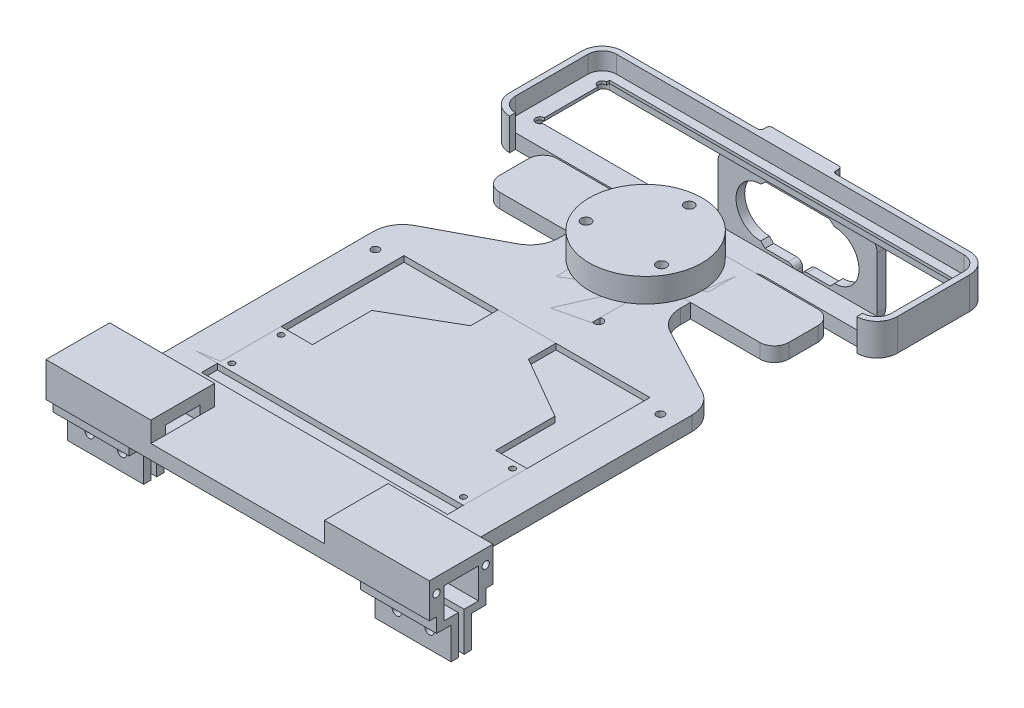
from build123d import *

# Parameters (mm, degrees)
BOSS_EXTRUDE1_START       = -2.5
BOSS_EXTRUDE1_DEPTH       = 5
BOSS_EXTRUDE1_2_OUTLINE_R = 1
BOSS_EXTRUDE1_2_DEPTH     = 5
BOSS_EXTRUDE1_START_2     = -7.5
BOSS_EXTRUDE1_3_OUTLINE_W = 20
BOSS_EXTRUDE1_3_OUTLINE_H = 5
BOSS_EXTRUDE1_3_OUTLINE_R = 1
BOSS_EXTRUDE1_3_DEPTH     = 5
BOSS_EXTRUDE1_START_3     = -0.5
BOSS_EXTRUDE1_4_OUTLINE_W = 20
BOSS_EXTRUDE1_4_OUTLINE_H = 12
BOSS_EXTRUDE1_4_DEPTH     = 3
BOSS_EXTRUDE1_5_OUTLINE_W = 20
BOSS_EXTRUDE1_5_OUTLINE_H = 12
BOSS_EXTRUDE1_5_DEPTH     = 2
SKETCH2_W                 = 20
SKETCH2_H                 = 12
CUT_EXTRUDE1_DEPTH        = 3
BOSS_EXTRUDE3_START       = -5
BOSS_EXTRUDE3_DEPTH       = 11
BOSS_EXTRUDE4_DEPTH       = 20
BOSS_EXTRUDE5_DEPTH       = 20
CUT_EXTRUDE8_DEPTH        = 120.378599422
CUT_EXTRUDE9_DEPTH        = 4
SKETCH17_W                = 30
SKETCH17_H                = 22
BOSS_EXTRUDE6_DEPTH       = 5
SKETCH18_W                = 12
SKETCH18_H                = 5
CUT_EXTRUDE11_DEPTH       = 30
SKETCH19_W                = 12
SKETCH19_H                = 5
CUT_EXTRUDE12_DEPTH       = 30
SKETCH16_W                = 85
SKETCH16_H                = 70
CUT_EXTRUDE13_DEPTH       = 2
SKETCH20_R                = 19.5
BOSS_EXTRUDE7_DEPTH       = 13.29
FILLET1_R                 = 10
FILLET2_R                 = 5
SKETCH21_W                = 30
SKETCH21_H                = 22
BOSS_EXTRUDE8_DEPTH       = 5
CUT_EXTRUDE14_DEPTH       = 122.873516811
CUT_EXTRUDE14_DEPTH_BACK  = 122.873516811
SKETCH22_R                = 1.7
SKETCH23_R                = 1.5
SKETCH23_R_2              = 1.35
CUT_EXTRUDE15_DEPTH       = 120.378599422
SKETCH26_W                = 30
SKETCH26_H                = 22
CUT_EXTRUDE17_DEPTH       = 3
BOSS_EXTRUDE11_DEPTH      = 6.25
SKETCH14_R                = 1.6
CUT_EXTRUDE6_DEPTH        = 199.094674335
BOSS_EXTRUDE10_DEPTH      = 3
BOSS_EXTRUDE12_DEPTH      = 10
SKETCH41_R                = 1.25
CUT_EXTRUDE19_DEPTH       = 9
SKETCH42_R                = 1.5
CUT_EXTRUDE20_DEPTH       = 125.102779985
FILLET4_R                 = 1


# Read off the part's stored shape, not the designer's step: Boss-Extrude1
with BuildPart() as part:
    # Boss-Extrude1 outline → Boss-Extrude1 (new body)
    with BuildSketch(Plane(origin=(0, 0, 0), x_dir=(1, 0, 0), z_dir=(0, 1, 0)).offset(BOSS_EXTRUDE1_START)):
        with BuildLine():
            Line((-60, 60.5), (-21, 60.5))
            Line((-21, 60.5), (-21, 30.5))
            Line((-21, 30.5), (-55, 12.5))
            Line((-55, 12.5), (-55, -73.5))
            Line((-55, -73.5), (-60, -73.5))
            Line((-60, -73.5), (-60, -95.5))
            Line((-60, -95.5), (60, -95.5))
            Line((60, -95.5), (60, -73.5))
            Line((60, -73.5), (55, -73.5))
            Line((55, -73.5), (55, 12.5))
            Line((55, 12.5), (21, 30.5))
            Line((21, 30.5), (21, 60.5))
            Line((21, 60.5), (60, 60.5))
            ThreePointArc((60, 60.5), (63.535533906, 61.964466094), (65, 65.5))
            Line((65, 65.5), (65, 90.5))
            ThreePointArc((65, 90.5), (63.535533906, 94.035533906), (60, 95.5))
            Line((60, 95.5), (-60, 95.5))
            ThreePointArc((-60, 95.5), (-63.535533906, 94.035533906), (-65, 90.5))
            Line((-65, 90.5), (-65, 65.5))
            ThreePointArc((-65, 65.5), (-63.535533906, 61.964466094), (-60, 60.5))
        make_face()
    extrude(amount=BOSS_EXTRUDE1_DEPTH)

    # Sketch2 → Cut-Extrude1 (cut)
    with BuildSketch(Plane.XZ.offset(2.5)):
        with Locations((-50, 84.5)):
            Rectangle(SKETCH2_W, SKETCH2_H)
        with Locations((50, 84.5)):
            Rectangle(SKETCH2_W, SKETCH2_H)
    extrude(amount=-CUT_EXTRUDE1_DEPTH, mode=Mode.SUBTRACT)

    # Sketch5 → Boss-Extrude3 (add)
    with BuildSketch(Plane(origin=(0, 2.5, 0), x_dir=(1, 0, 0), z_dir=(0, 1, 0)).offset(BOSS_EXTRUDE3_START)):
        with BuildLine():
            Line((-60, 60.5), (-60, 58.5))
            ThreePointArc((-60, 58.5), (-64.949747468, 60.550252532), (-67, 65.5))
            Line((-67, 65.5), (-67, 90.5))
            ThreePointArc((-67, 90.5), (-64.949747468, 95.449747468), (-60, 97.5))
            Line((-60, 97.5), (60, 97.5))
            ThreePointArc((60, 97.5), (64.949747468, 95.449747468), (67, 90.5))
            Line((67, 90.5), (67, 65.5))
            ThreePointArc((67, 65.5), (64.949747468, 60.550252532), (60, 58.5))
            Line((60, 58.5), (60, 60.5))
            ThreePointArc((60, 60.5), (63.535533906, 61.964466094), (65, 65.5))
            Line((65, 65.5), (65, 90.5))
            ThreePointArc((65, 90.5), (63.535533906, 94.035533906), (60, 95.5))
            Line((60, 95.5), (-60, 95.5))
            ThreePointArc((-60, 95.5), (-63.535533906, 94.035533906), (-65, 90.5))
            Line((-65, 90.5), (-65, 65.5))
            ThreePointArc((-65, 65.5), (-63.535533906, 61.964466094), (-60, 60.5))
        make_face()
    extrude(amount=BOSS_EXTRUDE3_DEPTH)

    # Sketch12 → Boss-Extrude4 (add)
    with BuildSketch(Plane.ZY.offset(60)):
        Polygon((78.5, -2.5), (78.5, -5), (83.5, -5), (83.5, -18.5), (81, -18.5), (81, -7.5), (76, -7.5), (76, -5), (76, -2.5), align=None)
        Polygon((85.5, -18.5), (88, -18.5), (88, -7.5), (93, -7.5), (93, -5), (93, -2.5), (90.5, -2.5), (90.5, -5), (85.5, -5), align=None)
    extrude(amount=-BOSS_EXTRUDE4_DEPTH)

    # Sketch13 → Boss-Extrude5 (add)
    with BuildSketch(Plane(origin=(60, 0, 0), x_dir=(0, 0, -1), z_dir=(1, 0, 0))):
        Polygon((-90.5, -2.5), (-90.5, -5), (-85.5, -5), (-85.5, -18.5), (-88, -18.5), (-88, -7.5), (-93, -7.5), (-93, -2.5), align=None)
        Polygon((-83.5, -18.5), (-81, -18.5), (-81, -7.5), (-76, -7.5), (-76, -2.5), (-78.5, -2.5), (-78.5, -5), (-83.5, -5), align=None)
    extrude(amount=-BOSS_EXTRUDE5_DEPTH)

    # Sketch15 → Cut-Extrude8 (cut, through all)
    with BuildSketch(Plane.XZ.offset(2.5)):
        with BuildLine():
            Line((-59.5, -91.5), (-59.5, -92.5))
            Line((-59.5, -92.5), (59.5, -92.5))
            Line((59.5, -92.5), (59.5, -91.5))
            ThreePointArc((59.5, -91.5), (61, -90), (59.5, -88.5))
            Line((59.5, -88.5), (59.5, -70))
            ThreePointArc((59.5, -70), (60.724744871, -67.633974596), (58.085786438, -68))
            Line((58.085786438, -68), (-58.085786438, -68))
            ThreePointArc((-58.085786438, -68), (-60.724744871, -67.633974596), (-59.5, -70))
            Line((-59.5, -70), (-59.5, -88.5))
            ThreePointArc((-59.5, -88.5), (-61, -90), (-59.5, -91.5))
        make_face()
    extrude(amount=-CUT_EXTRUDE8_DEPTH, mode=Mode.SUBTRACT)

    # Sketch15<3> → Cut-Extrude9 (cut)
    with BuildSketch(Plane.XZ.offset(2.5)):
        with BuildLine():
            Line((-61.5, -64.5), (61.5, -64.5))
            ThreePointArc((61.5, -64.5), (62.914213562, -65.085786438), (63.5, -66.5))
            Line((63.5, -66.5), (63.5, -92.5))
            ThreePointArc((63.5, -92.5), (62.914213562, -93.914213562), (61.5, -94.5))
            Line((61.5, -94.5), (-61.5, -94.5))
            ThreePointArc((-61.5, -94.5), (-62.914213562, -93.914213562), (-63.5, -92.5))
            Line((-63.5, -92.5), (-63.5, -66.5))
            ThreePointArc((-63.5, -66.5), (-62.914213562, -65.085786438), (-61.5, -64.5))
        make_face()
    extrude(amount=-CUT_EXTRUDE9_DEPTH, mode=Mode.SUBTRACT)

    # Sketch17 → Boss-Extrude6 (add)
    with BuildSketch(Plane(origin=(0, 2.5, 0), x_dir=(1, 0, 0), z_dir=(0, 1, 0))):
        with Locations((-45, -84.5)):
            Rectangle(SKETCH17_W, SKETCH17_H)
        with Locations((45, -84.5)):
            Rectangle(SKETCH17_W, SKETCH17_H)
    extrude(amount=BOSS_EXTRUDE6_DEPTH)

    # Sketch18 → Cut-Extrude11 (cut)
    with BuildSketch(Plane(origin=(60, 0, 0), x_dir=(0, 0, -1), z_dir=(1, 0, 0))):
        with Locations((-84.5, 3)):
            Rectangle(SKETCH18_W, SKETCH18_H)
    extrude(amount=-CUT_EXTRUDE11_DEPTH, mode=Mode.SUBTRACT)

    # Sketch19 → Cut-Extrude12 (cut)
    with BuildSketch(Plane.ZY.offset(60)):
        with Locations((84.5, 3)):
            Rectangle(SKETCH19_W, SKETCH19_H)
    extrude(amount=-CUT_EXTRUDE12_DEPTH, mode=Mode.SUBTRACT)

    # Sketch16 → Cut-Extrude13 (cut)
    with BuildSketch(Plane(origin=(0, 2.5, 0), x_dir=(1, 0, 0), z_dir=(0, 1, 0))):
        with Locations((0, -30.5)):
            Rectangle(SKETCH16_W, SKETCH16_H)
    extrude(amount=-CUT_EXTRUDE13_DEPTH, mode=Mode.SUBTRACT)

    # Sketch20 → Boss-Extrude7 (add)
    with BuildSketch(Plane.XZ.offset(2.5)):
        with Locations(Location((0, -45.5, 0), (0, 0, 270))):
            Circle(SKETCH20_R)
    extrude(amount=-BOSS_EXTRUDE7_DEPTH)

    # Fillet1
    fillet1_edges = [part.edges().sort_by_distance(p)[0] for p in [
        (21, 0, -30.5),
        (55, 0, -12.5),
        (-55, 0, -12.5),
        (-21, 0, -30.5),
    ]]
    fillet(fillet1_edges, radius=FILLET1_R)

    # Fillet2
    fillet2_edges = [part.edges().sort_by_distance(p)[0] for p in [
        (21, 0, -60.5),
        (-21, 0, -60.5),
    ]]
    fillet(fillet2_edges, radius=FILLET2_R)

    # Sketch21 → Boss-Extrude8 (add)
    with BuildSketch(Plane(origin=(0, 7.5, 0), x_dir=(1, 0, 0), z_dir=(0, 1, 0))):
        with Locations((45, -84.5)):
            Rectangle(SKETCH21_W, SKETCH21_H)
        with Locations((-45, -84.5)):
            Rectangle(SKETCH21_W, SKETCH21_H)
    extrude(amount=BOSS_EXTRUDE8_DEPTH)

    # Sketch22 → Cut-Extrude14 (cut, two sides: drawn at the far end of the back side and taken through both)
    with BuildSketch(Plane(origin=(0, 10.79, 0), x_dir=(1, 0, 0), z_dir=(0, 1, 0)).offset(-CUT_EXTRUDE14_DEPTH_BACK)):
        with Locations(Location((0, 60.575, 0), (0, 0, 270))):
            Circle(SKETCH22_R)
        with Locations(Location((13.055332962, 37.9625, 0), (0, 0, 270))):
            Circle(SKETCH22_R)
        with Locations(Location((-13.055332962, 37.9625, 0), (0, 0, 270))):
            Circle(SKETCH22_R)
    extrude(amount=CUT_EXTRUDE14_DEPTH + CUT_EXTRUDE14_DEPTH_BACK, mode=Mode.SUBTRACT)

    # Sketch23 → Cut-Extrude15 (cut, through all)
    with BuildSketch(Plane.XZ.offset(2.5)):
        with Locations(Location((0, 52.5, 0), (0, 0, 270))):
            Circle(SKETCH23_R)
        with Locations(Location((0, 11.5, 0), (0, 0, 270))):
            Circle(SKETCH23_R)
        with Locations(Location((-49.2665, 70.15, 0), (0, 0, 270))):
            Circle(SKETCH23_R_2)
        with Locations(Location((49.2665, 70.15, 0), (0, 0, 270))):
            Circle(SKETCH23_R_2)
        with Locations(Location((49.2665, -1.35, 0), (0, 0, 270))):
            Circle(SKETCH23_R_2)
        with Locations(Location((-49.2665, -1.35, 0), (0, 0, 270))):
            Circle(SKETCH23_R_2)
    extrude(amount=-CUT_EXTRUDE15_DEPTH, mode=Mode.SUBTRACT)

    # Sketch26 → Cut-Extrude17 (cut)
    with BuildSketch(Plane(origin=(0, 12.5, 0), x_dir=(1, 0, 0), z_dir=(0, 1, 0))):
        with Locations((45, -84.5)):
            Rectangle(SKETCH26_W, SKETCH26_H)
        with Locations((-45, -84.5)):
            Rectangle(SKETCH26_W, SKETCH26_H)
    extrude(amount=-CUT_EXTRUDE17_DEPTH, mode=Mode.SUBTRACT)

    # Sketch30 → Boss-Extrude11 (add)
    with BuildSketch(Plane(origin=(60, 0, 0), x_dir=(0, 0, -1), z_dir=(1, 0, 0))):
        Polygon((-73.5, -2.5), (-73.5, 9.5), (-95.5, 9.5), (-95.5, -2.5), (-93, -2.5), (-93, -7.5), (-88, -7.5), (-88, -18.5), (-85.5, -18.5), (-85.5, -5), (-90.5, -5), (-90.5, 5.5), (-78.5, 5.5), (-78.5, -5), (-83.5, -5), (-83.5, -18.5), (-81, -18.5), (-81, -7.5), (-76, -7.5), (-76, -2.5), align=None)
    boss_extrude11 = extrude(amount=BOSS_EXTRUDE11_DEPTH)

    # Mirror2: Boss-Extrude11 across plane
    add(boss_extrude11.mirror(Plane(origin=(0, 0, 0), x_dir=(0, 0, 1), z_dir=(1, 0, 0))))

    # Sketch14 → Cut-Extrude6 (cut, through all)
    with BuildSketch(Plane.XY.offset(88)):
        with Locations((-58.75, -12.5)):
            Circle(SKETCH14_R)
        with Locations((-47.5, -12.5)):
            Circle(SKETCH14_R)
        with Locations((47.5, -12.5)):
            Circle(SKETCH14_R)
        with Locations((58.75, -12.5)):
            Circle(SKETCH14_R)
    extrude(amount=-CUT_EXTRUDE6_DEPTH, mode=Mode.SUBTRACT)

    # Sketch29 → Boss-Extrude10 (add)
    with BuildSketch(Plane(origin=(0, 0, -97.5), x_dir=(-1, 0, 0), z_dir=(0, 0, -1))):
        with BuildLine():
            Line((0.749999494, -27.999999944), (0.749999466, -28.999999944))
            ThreePointArc((0.749999466, -28.999999944), (1.335785884, -30.414213543), (2.749999466, -31))
            Line((2.749999466, -31), (21.999999551, -31))
            ThreePointArc((21.999999551, -31), (25.535533407, -29.535533956), (26.999999551, -26.00000014))
            Line((26.999999551, -26.00000014), (27.000000055, -8.00000014))
            ThreePointArc((27.000000055, -8.00000014), (25.535534011, -4.464466144), (22.000000055, -3))
            Line((22.000000055, -3), (12.250000055, -3))
            Line((12.250000055, -3), (12.250000202, 5.5))
            Line((12.250000202, 5.5), (12.250000202, 8.5))
            Line((12.250000202, 8.5), (-12.749999798, 8.5))
            Line((-12.749999798, 8.5), (-12.749999798, 5.5))
            Line((-12.749999798, 5.5), (-12.749999945, -3))
            Line((-12.749999945, -3), (-22.999999945, -3))
            ThreePointArc((-22.999999945, -3), (-26.535533801, -4.464466044), (-27.999999945, -7.99999986))
            Line((-27.999999945, -7.99999986), (-28.000000449, -25.99999986))
            ThreePointArc((-28.000000449, -25.99999986), (-26.535534405, -29.535533856), (-23.000000449, -31))
            Line((-23.000000449, -31), (-3.750000534, -31))
            ThreePointArc((-3.750000534, -31), (-2.335786991, -30.414213582), (-1.750000534, -29.000000056))
            Line((-1.750000534, -29.000000056), (-1.750000506, -28.000000056))
            ThreePointArc((-1.750000506, -28.000000056), (-2.335786923, -26.585786457), (-3.750000506, -26))
            Line((-3.750000506, -26), (-11.754099977, -26))
            Line((-11.754099977, -26), (-13.2500001, -24.5))
            ThreePointArc((-13.2500001, -24.5), (-21.7500001, -16), (-13.2500001, -7.5))
            Line((-13.2500001, -7.5), (-11.500000135, -6))
            Line((-11.500000135, -6), (10.499999865, -6))
            Line((10.499999865, -6), (12.249999831, -7.5))
            ThreePointArc((12.249999831, -7.5), (20.749999831, -16), (12.249999831, -24.5))
            Line((12.249999831, -24.5), (10.749999494, -26))
            Line((10.749999494, -26), (2.749999494, -26))
            ThreePointArc((2.749999494, -26), (1.335785952, -26.585786418), (0.749999494, -27.999999944))
        make_face()
    extrude(amount=BOSS_EXTRUDE10_DEPTH)

    # Sketch32 → Boss-Extrude12 (add)
    with BuildSketch(Plane(origin=(40, 0, 0), x_dir=(0, 0, -1), z_dir=(1, 0, 0))):
        Polygon((-90.5, 5.5), (-90.5, -5), (-90, 5.5), align=None)
        Polygon((-78.5, -5), (-79, 5.5), (-78.5, 5.5), align=None)
    boss_extrude12 = extrude(amount=BOSS_EXTRUDE12_DEPTH)

    # Mirror3: Boss-Extrude12 across plane
    add(boss_extrude12.mirror(Plane(origin=(0, 0, 0), x_dir=(0, 0, 1), z_dir=(1, 0, 0))))

    # Sketch41 → Cut-Extrude19 (cut)
    with BuildSketch(Plane.ZY.offset(66.25)):
        with Locations((76, 4.5)):
            Circle(SKETCH41_R)
        with Locations((93, 4.5)):
            Circle(SKETCH41_R)
    cut_extrude19 = extrude(amount=-CUT_EXTRUDE19_DEPTH, mode=Mode.SUBTRACT)

    # Sketch42 → Cut-Extrude20 (cut, through all)
    with BuildSketch(Plane.XZ.offset(2.5)):
        with Locations(Location((10.75, -18.5, 0), (0, 0, 270))):
            Circle(SKETCH42_R)
    extrude(amount=-CUT_EXTRUDE20_DEPTH, mode=Mode.SUBTRACT)

    # Mirror7: Cut-Extrude19 across plane
    add(cut_extrude19.mirror(Plane(origin=(0, 0, 0), x_dir=(0, 0, 1), z_dir=(1, 0, 0))), mode=Mode.SUBTRACT)

    # Fillet4
    fillet4_edges = [part.edges().sort_by_distance(p)[0] for p in [
        (12.749999871, 1.25, -100.5),
        (-12.250000129, 1.25, -100.5),
        (12.749999867, 1.5, -97.5),
        (-12.250000133, 1.5, -97.5),
    ]]
    fillet(fillet4_edges, radius=FILLET4_R)


with BuildPart() as body_2:
    # Boss-Extrude1 2 outline → Boss-Extrude1 2 (new body)
    with BuildSketch(Plane(origin=(0, 0, 0), x_dir=(1, 0, 0), z_dir=(0, 1, 0)).offset(BOSS_EXTRUDE1_START)):
        with BuildLine():
            Line((-45, 40), (-10, 40))
            Line((-10, 40), (-10, -5))
            Line((-10, -5), (-31.650635095, -17.5))
            Line((-31.650635095, -17.5), (-31.650635095, -38))
            Line((-31.650635095, -38), (-50, -38))
            Line((-50, -38), (-50, -43))
            Line((-50, -43), (-30, -43))
            Line((-30, -43), (-30, -55))
            Line((-30, -55), (-50, -55))
            Line((-50, -55), (-50, -60))
            Line((-50, -60), (50, -60))
            Line((50, -60), (50, -55))
            Line((50, -55), (30, -55))
            Line((30, -55), (30, -43))
            Line((30, -43), (50, -43))
            Line((50, -43), (50, -38))
            Line((50, -38), (31.650635095, -38))
            Line((31.650635095, -38), (31.650635095, -17.5))
            Line((31.650635095, -17.5), (10, -5))
            Line((10, -5), (10, 40))
            Line((10, 40), (45, 40))
            ThreePointArc((45, 40), (48.535533906, 41.464466094), (50, 45))
            Line((50, 45), (50, 55))
            ThreePointArc((50, 55), (48.535533906, 58.535533906), (45, 60))
            Line((45, 60), (-45, 60))
            ThreePointArc((-45, 60), (-48.535533906, 58.535533906), (-50, 55))
            Line((-50, 55), (-50, 45))
            ThreePointArc((-50, 45), (-48.535533906, 41.464466094), (-45, 40))
        make_face()
        with Locations((40, -40.5)):
            Circle(BOSS_EXTRUDE1_2_OUTLINE_R, mode=Mode.SUBTRACT)
        with Locations((40, -57.5)):
            Circle(BOSS_EXTRUDE1_2_OUTLINE_R, mode=Mode.SUBTRACT)
        with Locations((-40, -57.5)):
            Circle(BOSS_EXTRUDE1_2_OUTLINE_R, mode=Mode.SUBTRACT)
        with Locations((-40, -40.5)):
            Circle(BOSS_EXTRUDE1_2_OUTLINE_R, mode=Mode.SUBTRACT)
    extrude(amount=BOSS_EXTRUDE1_2_DEPTH)

    # Boss-Extrude1 3 outline → Boss-Extrude1 3 (add)
    # profile 1 of 4: a face of its own
    with BuildSketch(Plane(origin=(0, 0, 0), x_dir=(1, 0, 0), z_dir=(0, 1, 0)).offset(BOSS_EXTRUDE1_START_2)):
        with Locations((-40, -40.5)):
            Rectangle(BOSS_EXTRUDE1_3_OUTLINE_W, BOSS_EXTRUDE1_3_OUTLINE_H)
        with Locations((-40, -40.5)):
            Circle(BOSS_EXTRUDE1_3_OUTLINE_R, mode=Mode.SUBTRACT)
    # profile 2 of 4: a face of its own
    with BuildSketch(Plane(origin=(0, 0, 0), x_dir=(1, 0, 0), z_dir=(0, 1, 0)).offset(BOSS_EXTRUDE1_START_2)):
        with Locations((-40, -57.5)):
            Rectangle(BOSS_EXTRUDE1_3_OUTLINE_W, BOSS_EXTRUDE1_3_OUTLINE_H)
        with Locations((-40, -57.5)):
            Circle(BOSS_EXTRUDE1_3_OUTLINE_R, mode=Mode.SUBTRACT)
    # profile 3 of 4: a face of its own
    with BuildSketch(Plane(origin=(0, 0, 0), x_dir=(1, 0, 0), z_dir=(0, 1, 0)).offset(BOSS_EXTRUDE1_START_2)):
        with Locations((40, -57.5)):
            Rectangle(BOSS_EXTRUDE1_3_OUTLINE_W, BOSS_EXTRUDE1_3_OUTLINE_H)
        with Locations((40, -57.5)):
            Circle(BOSS_EXTRUDE1_3_OUTLINE_R, mode=Mode.SUBTRACT)
    # profile 4 of 4: a face of its own
    with BuildSketch(Plane(origin=(0, 0, 0), x_dir=(1, 0, 0), z_dir=(0, 1, 0)).offset(BOSS_EXTRUDE1_START_2)):
        with Locations((40, -40.5)):
            Rectangle(BOSS_EXTRUDE1_3_OUTLINE_W, BOSS_EXTRUDE1_3_OUTLINE_H)
        with Locations((40, -40.5)):
            Circle(BOSS_EXTRUDE1_3_OUTLINE_R, mode=Mode.SUBTRACT)
    extrude(amount=BOSS_EXTRUDE1_3_DEPTH)

    # Boss-Extrude1 4 outline → Boss-Extrude1 4 (add)
    with BuildSketch(Plane(origin=(0, 0, 0), x_dir=(1, 0, 0), z_dir=(0, 1, 0)).offset(BOSS_EXTRUDE1_START_3)):
        with Locations((-40, -49)):
            Rectangle(BOSS_EXTRUDE1_4_OUTLINE_W, BOSS_EXTRUDE1_4_OUTLINE_H)
        with Locations((40, -49)):
            Rectangle(BOSS_EXTRUDE1_4_OUTLINE_W, BOSS_EXTRUDE1_4_OUTLINE_H)
    extrude(amount=BOSS_EXTRUDE1_4_DEPTH)

    # Boss-Extrude1 5 outline → Boss-Extrude1 5 (add)
    with BuildSketch(Plane(origin=(0, 0, 0), x_dir=(1, 0, 0), z_dir=(0, 1, 0)).offset(BOSS_EXTRUDE1_START_2)):
        with Locations((-40, -49)):
            Rectangle(BOSS_EXTRUDE1_5_OUTLINE_W, BOSS_EXTRUDE1_5_OUTLINE_H)
        with Locations((40, -49)):
            Rectangle(BOSS_EXTRUDE1_5_OUTLINE_W, BOSS_EXTRUDE1_5_OUTLINE_H)
    extrude(amount=BOSS_EXTRUDE1_5_DEPTH)


solid = Compound([part.part, body_2.part])
